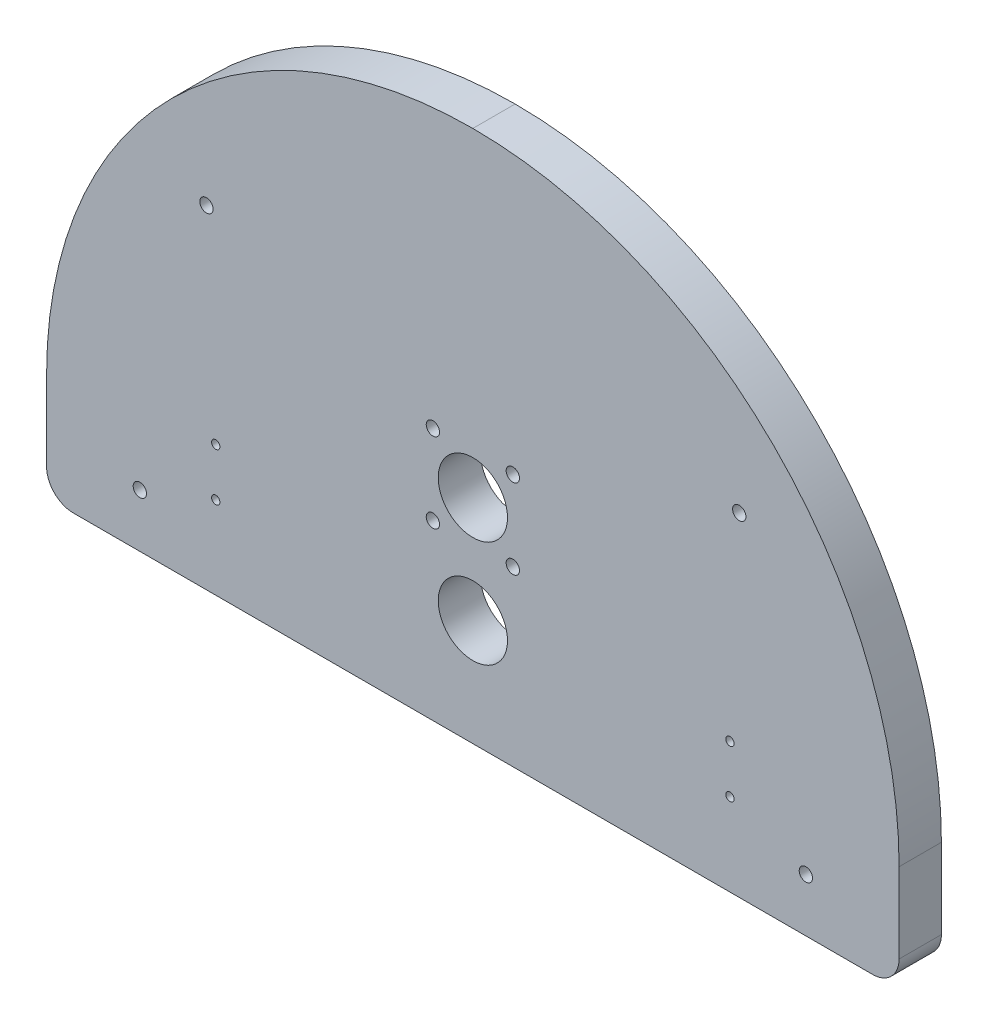
from build123d import *

# Parameters (mm, degrees)
SKETCH1_W           = 320
SKETCH1_H           = 200
BOSS_EXTRUDE1_DEPTH = 15.875
FILLET1_R           = 160
FILLET2_R           = 10
SKETCH2_R           = 13
CUT_EXTRUDE1_DEPTH  = 190.346284952
SKETCH3_R           = 2.5
CUT_EXTRUDE2_DEPTH  = 190.346284952
SKETCH4_R           = 2.5
CUT_EXTRUDE3_DEPTH  = 190.346284952
SKETCH5_R           = 1.5625
CUT_EXTRUDE4_DEPTH  = 190.346284952


with BuildPart() as part:
    # Sketch1 → Boss-Extrude1 (new body)
    with BuildSketch(Plane.XY):
        Rectangle(SKETCH1_W, SKETCH1_H)
    extrude(amount=BOSS_EXTRUDE1_DEPTH)

    # Fillet1
    fillet1_edges = [part.edges().sort_by_distance(p)[0] for p in [
        (-160, 100, 7.9375),
        (160, 100, 7.9375),
    ]]
    fillet(fillet1_edges, radius=FILLET1_R - 0.0001)  # a hair under: the kernel refuses the full size

    # Fillet2
    fillet2_edges = [part.edges().sort_by_distance(p)[0] for p in [
        (160, -100, 7.9375),
        (-160, -100, 7.9375),
    ]]
    fillet(fillet2_edges, radius=FILLET2_R)

    # Sketch2 → Cut-Extrude1 (cut, through all)
    with BuildSketch(Plane.XY.offset(15.875)):
        with Locations((0, -60)):
            Circle(SKETCH2_R)
        with Locations((0, -20)):
            Circle(SKETCH2_R)
    extrude(amount=-CUT_EXTRUDE1_DEPTH, mode=Mode.SUBTRACT)

    # Sketch3 → Cut-Extrude2 (cut, through all)
    with BuildSketch(Plane.XY.offset(15.875)):
        with Locations((-15, -5)):
            Circle(SKETCH3_R)
        with Locations((-15, -35)):
            Circle(SKETCH3_R)
        with Locations((15, -35)):
            Circle(SKETCH3_R)
        with Locations((15, -5)):
            Circle(SKETCH3_R)
    extrude(amount=-CUT_EXTRUDE2_DEPTH, mode=Mode.SUBTRACT)

    # Sketch4 → Cut-Extrude3 (cut, through all)
    with BuildSketch(Plane.XY.offset(15.875)):
        with Locations((-100, 25)):
            Circle(SKETCH4_R)
        with Locations((100, 25)):
            Circle(SKETCH4_R)
        with Locations((125, -80)):
            Circle(SKETCH4_R)
        with Locations((-125, -80)):
            Circle(SKETCH4_R)
    extrude(amount=-CUT_EXTRUDE3_DEPTH, mode=Mode.SUBTRACT)

    # Sketch5 → Cut-Extrude4 (cut, through all)
    with BuildSketch(Plane(origin=(0, 0, 0), x_dir=(-1, 0, 0), z_dir=(0, 0, -1))):
        with Locations((96.5, -51)):
            Circle(SKETCH5_R)
        with Locations((96.5, -69)):
            Circle(SKETCH5_R)
        with Locations((-96.5, -51)):
            Circle(SKETCH5_R)
        with Locations((-96.5, -69)):
            Circle(SKETCH5_R)
    extrude(amount=-CUT_EXTRUDE4_DEPTH, mode=Mode.SUBTRACT)


solid = part.part
